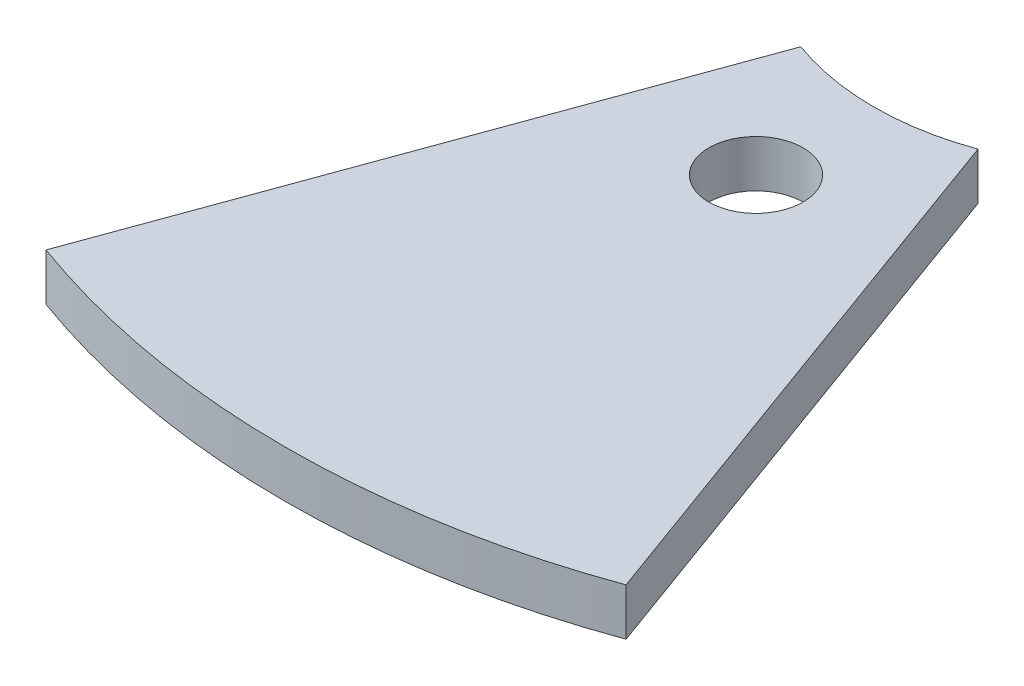
from build123d import *

# Parameters (mm, degrees)
SKETCH1_R           = 6.35
BOSS_EXTRUDE1_DEPTH = 6.35


with BuildPart() as part:
    # Sketch1 → Boss-Extrude1 (new body)
    with BuildSketch(Plane(origin=(0, 0, 0), x_dir=(1, 0, 0), z_dir=(0, 1, 0))):
        with BuildLine():
            ThreePointArc((11.945053506, 17.981235219), (0, 15.875), (-11.945053506, 17.981235219))
            Line((-11.945053506, 17.981235219), (-39.092902382, -56.606866556))
            ThreePointArc((-39.092902382, -56.606866556), (0, -63.5), (39.092902382, -56.606866556))
            Line((39.092902382, -56.606866556), (11.945053506, 17.981235219))
        make_face()
        Circle(SKETCH1_R, mode=Mode.SUBTRACT)
    extrude(amount=BOSS_EXTRUDE1_DEPTH)


solid = part.part
